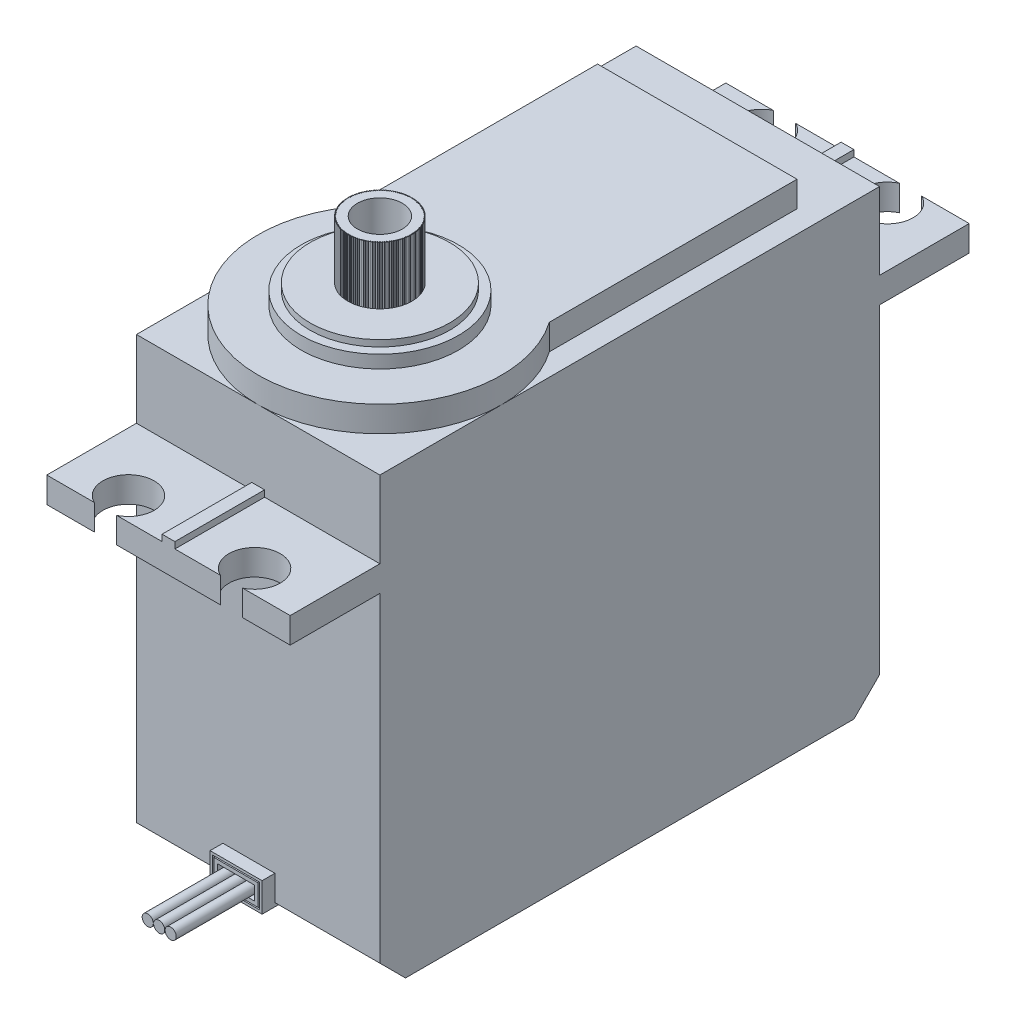
from build123d import *

# Parameters (mm, degrees)
SKETCH1_W            = 19
SKETCH1_H            = 39
BOSS_EXTRUDE1_DEPTH  = 35
SKETCH2_R            = 9.5
SKETCH2_R_2          = 6.134047939
BOSS_EXTRUDE2_DEPTH  = 2
SKETCH2_4_R          = 6.134047939
SKETCH2_4_R_2        = 5.444706805
BOSS_EXTRUDE3_DEPTH  = 3
SKETCH2_5_R          = 5.444706805
SKETCH2_5_R_2        = 2.5
BOSS_EXTRUDE4_DEPTH  = 3.5
SKETCH2_6_R          = 2.5
SKETCH2_6_R_2        = 1.75
BOSS_EXTRUDE5_DEPTH  = 8
BOSS_EXTRUDE6_DEPTH  = 2
SKETCH3_3_W          = 1
SKETCH3_3_H          = 7
BOSS_EXTRUDE7_DEPTH  = 2.5
CUT_EXTRUDE1_DEPTH   = 5
BOSS_EXTRUDE8_DEPTH  = 1
BOSS_EXTRUDE9_DEPTH  = 1
BOSS_EXTRUDE9_DRAFT  = 6
SKETCH6_4_R          = 0.434631118
BOSS_EXTRUDE10_DEPTH = 7
CHAMFER1_SIZE        = 2


with BuildPart() as part:
    # Sketch1 → Boss-Extrude1 (new body)
    with BuildSketch(Plane(origin=(0, 0, 0), x_dir=(1, 0, 0), z_dir=(0, 1, 0))):
        with Locations((9.5, 19.5)):
            Rectangle(SKETCH1_W, SKETCH1_H)
    extrude(amount=BOSS_EXTRUDE1_DEPTH)

    # Sketch2 → Boss-Extrude2 (add)
    # profile 1 of 2: a face of its own
    with BuildSketch(Plane(origin=(0, 35, 0), x_dir=(1, 0, 0), z_dir=(0, 1, 0))):
        with BuildLine():
            ThreePointArc((1.715067899, 14.944706805), (9.5, 19), (17.284932101, 14.944706805))
            Line((17.284932101, 14.944706805), (17.284932101, 34.275553608))
            Line((17.284932101, 34.275553608), (1.715067899, 34.275553608))
            Line((1.715067899, 34.275553608), (1.715067899, 14.944706805))
        make_face()
    # profile 2 of 2: a face of its own
    with BuildSketch(Plane(origin=(0, 35, 0), x_dir=(1, 0, 0), z_dir=(0, 1, 0))):
        with Locations((9.5, 9.5)):
            Circle(SKETCH2_R)
        with Locations(Location((9.5, 9.5, 0), (0, 0, 270))):
            Circle(SKETCH2_R_2, mode=Mode.SUBTRACT)
    extrude(amount=BOSS_EXTRUDE2_DEPTH)

    # Sketch2<4> → Boss-Extrude3 (add)
    with BuildSketch(Plane(origin=(0, 35, 0), x_dir=(1, 0, 0), z_dir=(0, 1, 0))):
        with Locations(Location((9.5, 9.5, 0), (0, 0, 270))):
            Circle(SKETCH2_4_R)
        with Locations(Location((9.5, 9.5, 0), (0, 0, 270))):
            Circle(SKETCH2_4_R_2, mode=Mode.SUBTRACT)
    extrude(amount=BOSS_EXTRUDE3_DEPTH)

    # Sketch2<5> → Boss-Extrude4 (add)
    with BuildSketch(Plane(origin=(0, 35, 0), x_dir=(1, 0, 0), z_dir=(0, 1, 0))):
        with Locations(Location((9.5, 9.5, 0), (0, 0, 270))):
            Circle(SKETCH2_5_R)
        with Locations(Location((9.5, 9.5, 0), (0, 0, 270))):
            Circle(SKETCH2_5_R_2, mode=Mode.SUBTRACT)
    extrude(amount=BOSS_EXTRUDE4_DEPTH)

    # Sketch2<6> → Boss-Extrude5 (add)
    with BuildSketch(Plane(origin=(0, 35, 0), x_dir=(1, 0, 0), z_dir=(0, 1, 0))):
        with Locations(Location((9.5, 9.5, 0), (0, 0, 270))):
            Circle(SKETCH2_6_R)
        with Locations(Location((9.5, 9.5, 0), (0, 0, 270))):
            Circle(SKETCH2_6_R_2, mode=Mode.SUBTRACT)
    extrude(amount=BOSS_EXTRUDE5_DEPTH)

    # Sketch3 → Boss-Extrude6 (add)
    with BuildSketch(Plane(origin=(0, 27, 0), x_dir=(1, 0, 0), z_dir=(0, 1, 0))):
        with BuildLine():
            Line((9, 0), (0, 0))
            Line((0, 0), (0, -7))
            Line((0, -7), (3.705809907, -7))
            ThreePointArc((3.705809907, -7), (4.579641768, -3.200995309), (5.453473629, -7))
            Line((5.453473629, -7), (9, -7))
            Line((9, -7), (9, 0))
        make_face()
        with BuildLine():
            Line((19, 0), (10, 0))
            Line((10, 0), (10, -7))
            Line((10, -7), (13.546526371, -7))
            ThreePointArc((13.546526371, -7), (14.420358232, -3.200995309), (15.294190093, -7))
            Line((15.294190093, -7), (19, -7))
            Line((19, -7), (19, 0))
        make_face()
        with BuildLine():
            Line((10, 46), (10, 39))
            Line((10, 39), (19, 39))
            Line((19, 39), (19, 46))
            Line((19, 46), (15.294190093, 46))
            ThreePointArc((15.294190093, 46), (14.420358232, 42.200995309), (13.546526371, 46))
            Line((13.546526371, 46), (10, 46))
        make_face()
        with BuildLine():
            Line((0, 46), (0, 39))
            Line((0, 39), (9, 39))
            Line((9, 39), (9, 46))
            Line((9, 46), (5.453473629, 46))
            ThreePointArc((5.453473629, 46), (4.579641768, 42.200995309), (3.705809907, 46))
            Line((3.705809907, 46), (0, 46))
        make_face()
    extrude(amount=BOSS_EXTRUDE6_DEPTH)

    # Sketch3<3> → Boss-Extrude7 (add)
    with BuildSketch(Plane(origin=(0, 27, 0), x_dir=(1, 0, 0), z_dir=(0, 1, 0))):
        Polygon((9, 46), (9, 39), (10, 39), (10, 46), (9.5, 46), align=None)
        with Locations((9.5, -3.5)):
            Rectangle(SKETCH3_3_W, SKETCH3_3_H)
    extrude(amount=BOSS_EXTRUDE7_DEPTH)

    # Sketch5 → Cut-Extrude1 (cut)
    with BuildSketch(Plane(origin=(0, 43, 0), x_dir=(1, 0, 0), z_dir=(0, 1, 0))):
        with BuildLine():
            Line((9.501733369, 7.074774865), (9.446313194, 7.007687285))
            ThreePointArc((9.446313194, 7.007687285), (9.502827188, 6.999662997), (9.559341183, 7.007687285))
            Line((9.559341183, 7.007687285), (9.501733369, 7.074774865))
        make_face()
        with BuildLine():
            Line((9.374804517, 7.078007835), (9.428822288, 7.007997235))
            ThreePointArc((9.428822288, 7.007997235), (9.371965786, 7.002941659), (9.3159492, 7.013912663))
            Line((9.3159492, 7.013912663), (9.374804517, 7.078007835))
        make_face()
        with BuildLine():
            Line((9.248218817, 7.087879316), (9.298498487, 7.015137592))
            ThreePointArc((9.298498487, 7.015137592), (9.241455316, 7.013064583), (9.186089677, 7.026952234))
            Line((9.186089677, 7.026952234), (9.248218817, 7.087879316))
        make_face()
        with BuildLine():
            Line((9.122323232, 7.104362253), (9.168726988, 7.029088784))
            ThreePointArc((9.168726988, 7.029088784), (9.111653499, 7.030004025), (9.057090561, 7.046770257))
            Line((9.057090561, 7.046770257), (9.122323232, 7.104362253))
        make_face()
        with BuildLine():
            Line((8.997462832, 7.127411466), (9.039863485, 7.049812572))
            ThreePointArc((9.039863485, 7.049812572), (8.982916113, 7.053713554), (8.929305429, 7.073312412))
            Line((8.929305429, 7.073312412), (8.997462832, 7.127411466))
        make_face()
        with BuildLine():
            Line((8.873979852, 7.156963779), (8.912261184, 7.077252153))
            ThreePointArc((8.912261184, 7.077252153), (8.855596018, 7.084128184), (8.80308453, 7.106505949))
            Line((8.80308453, 7.106505949), (8.873979852, 7.156963779))
        make_face()
        with BuildLine():
            Line((8.75221275, 7.192938192), (8.786269834, 7.111332318))
            ThreePointArc((8.786269834, 7.111332318), (8.73004219, 7.121164551), (8.678773829, 7.146259887))
            Line((8.678773829, 7.146259887), (8.75221275, 7.192938192))
        make_face()
        with BuildLine():
            Line((8.632495281, 7.235236101), (8.662234769, 7.151959655))
            ThreePointArc((8.662234769, 7.151959655), (8.606598763, 7.164721141), (8.556714051, 7.192465263))
            Line((8.556714051, 7.192465263), (8.632495281, 7.235236101))
        make_face()
        with BuildLine():
            Line((8.515155581, 7.28374157), (8.540495961, 7.199022807))
            ThreePointArc((8.540495961, 7.199022807), (8.485604086, 7.214678567), (8.437239755, 7.244995432))
            Line((8.437239755, 7.244995432), (8.515155581, 7.28374157))
        make_face()
        with BuildLine():
            Line((8.400515272, 7.338321649), (8.421387086, 7.252392777))
            ThreePointArc((8.421387086, 7.252392777), (8.367389798, 7.270899901), (8.32067841, 7.303706411))
            Line((8.32067841, 7.303706411), (8.400515272, 7.338321649))
        make_face()
        with BuildLine():
            Line((8.288888574, 7.398826739), (8.305234614, 7.311923283))
            ThreePointArc((8.305234614, 7.311923283), (8.252279915, 7.333231043), (8.207349504, 7.368437278))
            Line((8.207349504, 7.368437278), (8.288888574, 7.398826739))
        make_face()
        with BuildLine():
            Line((8.180581448, 7.465090999), (8.192356911, 7.377451155))
            ThreePointArc((8.192356911, 7.377451155), (8.140589947, 7.401501149), (8.097563664, 7.43901061))
            Line((8.097563664, 7.43901061), (8.180581448, 7.465090999))
        make_face()
        with BuildLine():
            Line((8.075890757, 7.536932802), (8.083063367, 7.448796786))
            ThreePointArc((8.083063367, 7.448796786), (8.032626027, 7.475523094), (7.991621803, 7.515232971))
            Line((7.991621803, 7.515232971), (8.075890757, 7.536932802))
        make_face()
        with BuildLine():
            Line((7.975103451, 7.614155237), (7.977653548, 7.525764623))
            ThreePointArc((7.977653548, 7.525764623), (7.928684077, 7.555093989), (7.889814303, 7.596895441))
            Line((7.889814303, 7.596895441), (7.975103451, 7.614155237))
        make_face()
        with BuildLine():
            Line((7.878495779, 7.69654664), (7.876416374, 7.608143701))
            ThreePointArc((7.876416374, 7.608143701), (7.829048995, 7.639995736), (7.792420209, 7.683774188))
            Line((7.792420209, 7.683774188), (7.878495779, 7.69654664))
        make_face()
        with BuildLine():
            Line((7.786332538, 7.783881185), (7.779629331, 7.695708226))
            ThreePointArc((7.779629331, 7.695708226), (7.733993874, 7.729995626), (7.699706473, 7.775631083))
            Line((7.699706473, 7.775631083), (7.786332538, 7.783881185))
        make_face()
        with BuildLine():
            Line((7.698866341, 7.875919491), (7.687557704, 7.788218189))
            ThreePointArc((7.687557704, 7.788218189), (7.643779252, 7.824846975), (7.611927217, 7.872214354))
            Line((7.611927217, 7.872214354), (7.698866341, 7.875919491))
        make_face()
        with BuildLine():
            Line((7.616336925, 7.972409289), (7.600453855, 7.885420027))
            ThreePointArc((7.600453855, 7.885420027), (7.558652403, 7.924289802), (7.529323037, 7.973259272))
            Line((7.529323037, 7.973259272), (7.616336925, 7.972409289))
        make_face()
        with BuildLine():
            Line((7.5389705, 8.073086108), (7.51855653, 7.987047317))
            ThreePointArc((7.51855653, 7.987047317), (7.478846653, 8.028051541), (7.452120345, 8.078488881))
            Line((7.452120345, 8.078488881), (7.5389705, 8.073086108))
        make_face()
        with BuildLine():
            Line((7.466979119, 8.177673998), (7.442090204, 8.092821505))
            ThreePointArc((7.442090204, 8.092821505), (7.404580743, 8.135847788), (7.380530749, 8.187614752))
            Line((7.380530749, 8.187614752), (7.466979119, 8.177673998))
        make_face()
        with BuildLine():
            Line((7.400560108, 8.285886291), (7.371264466, 8.202452671))
            ThreePointArc((7.371264466, 8.202452671), (7.336058232, 8.247383082), (7.314750471, 8.300337781))
            Line((7.314750471, 8.300337781), (7.400560108, 8.285886291))
        make_face()
        with BuildLine():
            Line((7.339895515, 8.397426386), (7.306273444, 8.315640324))
            ThreePointArc((7.306273444, 8.315640324), (7.273466934, 8.362351712), (7.25495981, 8.416349))
            Line((7.25495981, 8.416349), (7.339895515, 8.397426386))
        make_face()
        with BuildLine():
            Line((7.285151619, 8.511988559), (7.247295273, 8.432074225))
            ThreePointArc((7.247295273, 8.432074225), (7.216978409, 8.480438556), (7.201322649, 8.535330431))
            Line((7.201322649, 8.535330431), (7.285151619, 8.511988559))
        make_face()
        with BuildLine():
            Line((7.236478468, 8.629258802), (7.19449161, 8.551435236))
            ThreePointArc((7.19449161, 8.551435236), (7.166747488, 8.601319948), (7.153986002, 8.656955954))
            Line((7.153986002, 8.656955954), (7.236478468, 8.629258802))
        make_face()
        with BuildLine():
            Line((7.194009473, 8.748915687), (7.148007186, 8.673396197))
            ThreePointArc((7.148007186, 8.673396197), (7.12291185, 8.724664559), (7.113079616, 8.780892203))
            Line((7.113079616, 8.780892203), (7.194009473, 8.748915687))
        make_face()
        with BuildLine():
            Line((7.157861037, 8.870631241), (7.10796941, 8.797622822))
            ThreePointArc((7.10796941, 8.797622822), (7.085591645, 8.850134311), (7.078715613, 8.906799476))
            Line((7.078715613, 8.906799476), (7.157861037, 8.870631241))
        make_face()
        with BuildLine():
            Line((7.128132241, 8.994071851), (7.074488023, 8.923774614))
            ThreePointArc((7.074488023, 8.923774614), (7.054889165, 8.977385299), (7.050988183, 9.03433267))
            Line((7.050988183, 9.03433267), (7.128132241, 8.994071851))
        make_face()
        with BuildLine():
            Line((7.10490457, 9.118899175), (7.047654796, 9.0515058))
            ThreePointArc((7.047654796, 9.0515058), (7.030888564, 9.106068738), (7.029973323, 9.163142226))
            Line((7.029973323, 9.163142226), (7.10490457, 9.118899175))
        make_face()
        with BuildLine():
            Line((7.088241689, 9.24477107), (7.027543277, 9.180466277))
            ThreePointArc((7.027543277, 9.180466277), (7.013655627, 9.235831915), (7.015728635, 9.292875086))
            Line((7.015728635, 9.292875086), (7.088241689, 9.24477107))
        make_face()
        with BuildLine():
            Line((7.07818927, 9.37134253), (7.01420859, 9.310302573))
            ThreePointArc((7.01420859, 9.310302573), (7.003237586, 9.366319159), (7.008293163, 9.423175661))
            Line((7.008293163, 9.423175661), (7.07818927, 9.37134253))
        make_face()
        with BuildLine():
            Line((7.074774865, 9.498266631), (7.007687285, 9.440658817))
            ThreePointArc((7.007687285, 9.440658817), (6.999662997, 9.497172812), (7.007687285, 9.553686806))
            Line((7.007687285, 9.553686806), (7.074774865, 9.498266631))
        make_face()
        with BuildLine():
            Line((7.078007835, 9.625195483), (7.007997235, 9.571177712))
            ThreePointArc((7.007997235, 9.571177712), (7.002941659, 9.628034214), (7.013912663, 9.6840508))
            Line((7.013912663, 9.6840508), (7.078007835, 9.625195483))
        make_face()
        with BuildLine():
            Line((7.087879316, 9.751781183), (7.015137592, 9.701501513))
            ThreePointArc((7.015137592, 9.701501513), (7.013064583, 9.758544684), (7.026952234, 9.813910323))
            Line((7.026952234, 9.813910323), (7.087879316, 9.751781183))
        make_face()
        with BuildLine():
            Line((7.104362253, 9.877676768), (7.029088784, 9.831273012))
            ThreePointArc((7.029088784, 9.831273012), (7.030004025, 9.888346501), (7.046770257, 9.942909439))
            Line((7.046770257, 9.942909439), (7.104362253, 9.877676768))
        make_face()
        with BuildLine():
            Line((7.127411466, 10.002537168), (7.049812572, 9.960136515))
            ThreePointArc((7.049812572, 9.960136515), (7.053713554, 10.017083887), (7.073312412, 10.070694571))
            Line((7.073312412, 10.070694571), (7.127411466, 10.002537168))
        make_face()
        with BuildLine():
            Line((7.156963779, 10.126020148), (7.077252153, 10.087738816))
            ThreePointArc((7.077252153, 10.087738816), (7.084128184, 10.144403982), (7.106505949, 10.19691547))
            Line((7.106505949, 10.19691547), (7.156963779, 10.126020148))
        make_face()
        with BuildLine():
            Line((7.192938192, 10.24778725), (7.111332318, 10.213730166))
            ThreePointArc((7.111332318, 10.213730166), (7.121164551, 10.26995781), (7.146259887, 10.321226171))
            Line((7.146259887, 10.321226171), (7.192938192, 10.24778725))
        make_face()
        with BuildLine():
            Line((7.235236101, 10.367504719), (7.151959655, 10.337765231))
            ThreePointArc((7.151959655, 10.337765231), (7.164721141, 10.393401237), (7.192465263, 10.443285949))
            Line((7.192465263, 10.443285949), (7.235236101, 10.367504719))
        make_face()
        with BuildLine():
            Line((7.28374157, 10.484844419), (7.199022807, 10.459504039))
            ThreePointArc((7.199022807, 10.459504039), (7.214678567, 10.514395914), (7.244995432, 10.562760245))
            Line((7.244995432, 10.562760245), (7.28374157, 10.484844419))
        make_face()
        with BuildLine():
            Line((7.338321649, 10.599484728), (7.252392777, 10.578612914))
            ThreePointArc((7.252392777, 10.578612914), (7.270899901, 10.632610202), (7.303706411, 10.67932159))
            Line((7.303706411, 10.67932159), (7.338321649, 10.599484728))
        make_face()
        with BuildLine():
            Line((7.398826739, 10.711111426), (7.311923283, 10.694765386))
            ThreePointArc((7.311923283, 10.694765386), (7.333231043, 10.747720085), (7.368437278, 10.792650496))
            Line((7.368437278, 10.792650496), (7.398826739, 10.711111426))
        make_face()
        with BuildLine():
            Line((7.465090999, 10.819418552), (7.377451155, 10.807643089))
            ThreePointArc((7.377451155, 10.807643089), (7.401501149, 10.859410053), (7.43901061, 10.902436336))
            Line((7.43901061, 10.902436336), (7.465090999, 10.819418552))
        make_face()
        with BuildLine():
            Line((7.536932802, 10.924109243), (7.448796786, 10.916936633))
            ThreePointArc((7.448796786, 10.916936633), (7.475523094, 10.967373973), (7.515232971, 11.008378197))
            Line((7.515232971, 11.008378197), (7.536932802, 10.924109243))
        make_face()
        with BuildLine():
            Line((7.614155237, 11.024896549), (7.525764623, 11.022346452))
            ThreePointArc((7.525764623, 11.022346452), (7.555093989, 11.071315923), (7.596895441, 11.110185697))
            Line((7.596895441, 11.110185697), (7.614155237, 11.024896549))
        make_face()
        with BuildLine():
            Line((7.69654664, 11.121504221), (7.608143701, 11.123583626))
            ThreePointArc((7.608143701, 11.123583626), (7.639995736, 11.170951005), (7.683774188, 11.207579791))
            Line((7.683774188, 11.207579791), (7.69654664, 11.121504221))
        make_face()
        with BuildLine():
            Line((7.783881185, 11.213667462), (7.695708226, 11.220370669))
            ThreePointArc((7.695708226, 11.220370669), (7.729995626, 11.266006126), (7.775631083, 11.300293527))
            Line((7.775631083, 11.300293527), (7.783881185, 11.213667462))
        make_face()
        with BuildLine():
            Line((7.875919491, 11.301133659), (7.788218189, 11.312442296))
            ThreePointArc((7.788218189, 11.312442296), (7.824846975, 11.356220748), (7.872214354, 11.388072783))
            Line((7.872214354, 11.388072783), (7.875919491, 11.301133659))
        make_face()
        with BuildLine():
            Line((7.972409289, 11.383663075), (7.885420027, 11.399546145))
            ThreePointArc((7.885420027, 11.399546145), (7.924289802, 11.441347597), (7.973259272, 11.470676963))
            Line((7.973259272, 11.470676963), (7.972409289, 11.383663075))
        make_face()
        with BuildLine():
            Line((8.073086108, 11.4610295), (7.987047317, 11.48144347))
            ThreePointArc((7.987047317, 11.48144347), (8.028051541, 11.521153347), (8.078488881, 11.547879655))
            Line((8.078488881, 11.547879655), (8.073086108, 11.4610295))
        make_face()
        with BuildLine():
            Line((8.177673998, 11.533020881), (8.092821505, 11.557909796))
            ThreePointArc((8.092821505, 11.557909796), (8.135847788, 11.595419257), (8.187614752, 11.619469251))
            Line((8.187614752, 11.619469251), (8.177673998, 11.533020881))
        make_face()
        with BuildLine():
            Line((8.285886291, 11.599439892), (8.202452671, 11.628735534))
            ThreePointArc((8.202452671, 11.628735534), (8.247383082, 11.663941768), (8.300337781, 11.685249529))
            Line((8.300337781, 11.685249529), (8.285886291, 11.599439892))
        make_face()
        with BuildLine():
            Line((8.397426386, 11.660104485), (8.315640324, 11.693726556))
            ThreePointArc((8.315640324, 11.693726556), (8.362351712, 11.726533066), (8.416349, 11.74504019))
            Line((8.416349, 11.74504019), (8.397426386, 11.660104485))
        make_face()
        with BuildLine():
            Line((8.511988559, 11.714848381), (8.432074225, 11.752704727))
            ThreePointArc((8.432074225, 11.752704727), (8.480438556, 11.783021591), (8.535330431, 11.798677351))
            Line((8.535330431, 11.798677351), (8.511988559, 11.714848381))
        make_face()
        with BuildLine():
            Line((8.629258802, 11.763521532), (8.551435236, 11.80550839))
            ThreePointArc((8.551435236, 11.80550839), (8.601319948, 11.833252512), (8.656955954, 11.846013998))
            Line((8.656955954, 11.846013998), (8.629258802, 11.763521532))
        make_face()
        with BuildLine():
            Line((8.748915687, 11.805990527), (8.673396197, 11.851992814))
            ThreePointArc((8.673396197, 11.851992814), (8.724664559, 11.87708815), (8.780892203, 11.886920384))
            Line((8.780892203, 11.886920384), (8.748915687, 11.805990527))
        make_face()
        with BuildLine():
            Line((8.870631241, 11.842138963), (8.797622822, 11.89203059))
            ThreePointArc((8.797622822, 11.89203059), (8.850134311, 11.914408355), (8.906799476, 11.921284387))
            Line((8.906799476, 11.921284387), (8.870631241, 11.842138963))
        make_face()
        with BuildLine():
            Line((8.994071851, 11.871867759), (8.923774614, 11.925511977))
            ThreePointArc((8.923774614, 11.925511977), (8.977385299, 11.945110835), (9.03433267, 11.949011817))
            Line((9.03433267, 11.949011817), (8.994071851, 11.871867759))
        make_face()
        with BuildLine():
            Line((9.118899175, 11.89509543), (9.0515058, 11.952345204))
            ThreePointArc((9.0515058, 11.952345204), (9.106068738, 11.969111436), (9.163142226, 11.970026677))
            Line((9.163142226, 11.970026677), (9.118899175, 11.89509543))
        make_face()
        with BuildLine():
            Line((9.24477107, 11.911758311), (9.180466277, 11.972456723))
            ThreePointArc((9.180466277, 11.972456723), (9.235831915, 11.986344373), (9.292875086, 11.984271365))
            Line((9.292875086, 11.984271365), (9.24477107, 11.911758311))
        make_face()
        with BuildLine():
            Line((9.37134253, 11.92181073), (9.310302573, 11.98579141))
            ThreePointArc((9.310302573, 11.98579141), (9.366319159, 11.996762414), (9.423175661, 11.991706837))
            Line((9.423175661, 11.991706837), (9.37134253, 11.92181073))
        make_face()
        with BuildLine():
            Line((9.498266631, 11.925225135), (9.440658817, 11.992312715))
            ThreePointArc((9.440658817, 11.992312715), (9.497172812, 12.000337003), (9.553686806, 11.992312715))
            Line((9.553686806, 11.992312715), (9.498266631, 11.925225135))
        make_face()
        with BuildLine():
            Line((9.625195483, 11.921992165), (9.571177712, 11.992002765))
            ThreePointArc((9.571177712, 11.992002765), (9.628034214, 11.997058341), (9.6840508, 11.986087337))
            Line((9.6840508, 11.986087337), (9.625195483, 11.921992165))
        make_face()
        with BuildLine():
            Line((9.751781183, 11.912120684), (9.701501513, 11.984862408))
            ThreePointArc((9.701501513, 11.984862408), (9.758544684, 11.986935417), (9.813910323, 11.973047766))
            Line((9.813910323, 11.973047766), (9.751781183, 11.912120684))
        make_face()
        with BuildLine():
            Line((9.877676768, 11.895637747), (9.831273012, 11.970911216))
            ThreePointArc((9.831273012, 11.970911216), (9.888346501, 11.969995975), (9.942909439, 11.953229743))
            Line((9.942909439, 11.953229743), (9.877676768, 11.895637747))
        make_face()
        with BuildLine():
            Line((10.002537168, 11.872588534), (9.960136515, 11.950187428))
            ThreePointArc((9.960136515, 11.950187428), (10.017083887, 11.946286446), (10.070694571, 11.926687588))
            Line((10.070694571, 11.926687588), (10.002537168, 11.872588534))
        make_face()
        with BuildLine():
            Line((10.126020148, 11.843036221), (10.087738816, 11.922747847))
            ThreePointArc((10.087738816, 11.922747847), (10.144403982, 11.915871816), (10.19691547, 11.893494051))
            Line((10.19691547, 11.893494051), (10.126020148, 11.843036221))
        make_face()
        with BuildLine():
            Line((10.24778725, 11.807061808), (10.213730166, 11.888667682))
            ThreePointArc((10.213730166, 11.888667682), (10.26995781, 11.878835449), (10.321226171, 11.853740113))
            Line((10.321226171, 11.853740113), (10.24778725, 11.807061808))
        make_face()
        with BuildLine():
            Line((10.367504719, 11.764763899), (10.337765231, 11.848040345))
            ThreePointArc((10.337765231, 11.848040345), (10.393401237, 11.835278859), (10.443285949, 11.807534737))
            Line((10.443285949, 11.807534737), (10.367504719, 11.764763899))
        make_face()
        with BuildLine():
            Line((10.484844419, 11.71625843), (10.459504039, 11.800977193))
            ThreePointArc((10.459504039, 11.800977193), (10.514395914, 11.785321433), (10.562760245, 11.755004568))
            Line((10.562760245, 11.755004568), (10.484844419, 11.71625843))
        make_face()
        with BuildLine():
            Line((10.599484728, 11.661678351), (10.578612914, 11.747607223))
            ThreePointArc((10.578612914, 11.747607223), (10.632610202, 11.729100099), (10.67932159, 11.696293589))
            Line((10.67932159, 11.696293589), (10.599484728, 11.661678351))
        make_face()
        with BuildLine():
            Line((10.711111426, 11.601173261), (10.694765386, 11.688076717))
            ThreePointArc((10.694765386, 11.688076717), (10.747720085, 11.666768957), (10.792650496, 11.631562722))
            Line((10.792650496, 11.631562722), (10.711111426, 11.601173261))
        make_face()
        with BuildLine():
            Line((10.819418552, 11.534909001), (10.807643089, 11.622548845))
            ThreePointArc((10.807643089, 11.622548845), (10.859410053, 11.598498851), (10.902436336, 11.56098939))
            Line((10.902436336, 11.56098939), (10.819418552, 11.534909001))
        make_face()
        with BuildLine():
            Line((10.924109243, 11.463067198), (10.916936633, 11.551203214))
            ThreePointArc((10.916936633, 11.551203214), (10.967373973, 11.524476906), (11.008378197, 11.484767029))
            Line((11.008378197, 11.484767029), (10.924109243, 11.463067198))
        make_face()
        with BuildLine():
            Line((11.024896549, 11.385844763), (11.022346452, 11.474235377))
            ThreePointArc((11.022346452, 11.474235377), (11.071315923, 11.444906011), (11.110185697, 11.403104559))
            Line((11.110185697, 11.403104559), (11.024896549, 11.385844763))
        make_face()
        with BuildLine():
            Line((11.121504221, 11.30345336), (11.123583626, 11.391856299))
            ThreePointArc((11.123583626, 11.391856299), (11.170951005, 11.360004264), (11.207579791, 11.316225812))
            Line((11.207579791, 11.316225812), (11.121504221, 11.30345336))
        make_face()
        with BuildLine():
            Line((11.213667462, 11.216118815), (11.220370669, 11.304291774))
            ThreePointArc((11.220370669, 11.304291774), (11.266006126, 11.270004374), (11.300293527, 11.224368917))
            Line((11.300293527, 11.224368917), (11.213667462, 11.216118815))
        make_face()
        with BuildLine():
            Line((11.301133659, 11.124080509), (11.312442296, 11.211781811))
            ThreePointArc((11.312442296, 11.211781811), (11.356220748, 11.175153025), (11.388072783, 11.127785646))
            Line((11.388072783, 11.127785646), (11.301133659, 11.124080509))
        make_face()
        with BuildLine():
            Line((11.383663075, 11.027590711), (11.399546145, 11.114579973))
            ThreePointArc((11.399546145, 11.114579973), (11.441347597, 11.075710198), (11.470676963, 11.026740728))
            Line((11.470676963, 11.026740728), (11.383663075, 11.027590711))
        make_face()
        with BuildLine():
            Line((11.4610295, 10.926913892), (11.48144347, 11.012952683))
            ThreePointArc((11.48144347, 11.012952683), (11.521153347, 10.971948459), (11.547879655, 10.921511119))
            Line((11.547879655, 10.921511119), (11.4610295, 10.926913892))
        make_face()
        with BuildLine():
            Line((11.533020881, 10.822326002), (11.557909796, 10.907178495))
            ThreePointArc((11.557909796, 10.907178495), (11.595419257, 10.864152212), (11.619469251, 10.812385248))
            Line((11.619469251, 10.812385248), (11.533020881, 10.822326002))
        make_face()
        with BuildLine():
            Line((11.599439892, 10.714113709), (11.628735534, 10.797547329))
            ThreePointArc((11.628735534, 10.797547329), (11.663941768, 10.752616918), (11.685249529, 10.699662219))
            Line((11.685249529, 10.699662219), (11.599439892, 10.714113709))
        make_face()
        with BuildLine():
            Line((11.660104485, 10.602573614), (11.693726556, 10.684359676))
            ThreePointArc((11.693726556, 10.684359676), (11.726533066, 10.637648288), (11.74504019, 10.583651))
            Line((11.74504019, 10.583651), (11.660104485, 10.602573614))
        make_face()
        with BuildLine():
            Line((11.714848381, 10.488011441), (11.752704727, 10.567925775))
            ThreePointArc((11.752704727, 10.567925775), (11.783021591, 10.519561444), (11.798677351, 10.464669569))
            Line((11.798677351, 10.464669569), (11.714848381, 10.488011441))
        make_face()
        with BuildLine():
            Line((11.763521532, 10.370741198), (11.80550839, 10.448564764))
            ThreePointArc((11.80550839, 10.448564764), (11.833252512, 10.398680052), (11.846013998, 10.343044046))
            Line((11.846013998, 10.343044046), (11.763521532, 10.370741198))
        make_face()
        with BuildLine():
            Line((11.805990527, 10.251084313), (11.851992814, 10.326603803))
            ThreePointArc((11.851992814, 10.326603803), (11.87708815, 10.275335441), (11.886920384, 10.219107797))
            Line((11.886920384, 10.219107797), (11.805990527, 10.251084313))
        make_face()
        with BuildLine():
            Line((11.842138963, 10.129368759), (11.89203059, 10.202377178))
            ThreePointArc((11.89203059, 10.202377178), (11.914408355, 10.149865689), (11.921284387, 10.093200524))
            Line((11.921284387, 10.093200524), (11.842138963, 10.129368759))
        make_face()
        with BuildLine():
            Line((11.871867759, 10.005928149), (11.925511977, 10.076225386))
            ThreePointArc((11.925511977, 10.076225386), (11.945110835, 10.022614701), (11.949011817, 9.96566733))
            Line((11.949011817, 9.96566733), (11.871867759, 10.005928149))
        make_face()
        with BuildLine():
            Line((11.89509543, 9.881100825), (11.952345204, 9.9484942))
            ThreePointArc((11.952345204, 9.9484942), (11.969111436, 9.893931262), (11.970026677, 9.836857774))
            Line((11.970026677, 9.836857774), (11.89509543, 9.881100825))
        make_face()
        with BuildLine():
            Line((11.911758311, 9.75522893), (11.972456723, 9.819533723))
            ThreePointArc((11.972456723, 9.819533723), (11.986344373, 9.764168085), (11.984271365, 9.707124914))
            Line((11.984271365, 9.707124914), (11.911758311, 9.75522893))
        make_face()
        with BuildLine():
            Line((11.92181073, 9.62865747), (11.98579141, 9.689697427))
            ThreePointArc((11.98579141, 9.689697427), (11.996762414, 9.633680841), (11.991706837, 9.576824339))
            Line((11.991706837, 9.576824339), (11.92181073, 9.62865747))
        make_face()
        with BuildLine():
            Line((11.925225135, 9.501733369), (11.992312715, 9.559341183))
            ThreePointArc((11.992312715, 9.559341183), (12.000337003, 9.502827188), (11.992312715, 9.446313194))
            Line((11.992312715, 9.446313194), (11.925225135, 9.501733369))
        make_face()
        with BuildLine():
            Line((11.921992165, 9.374804517), (11.992002765, 9.428822288))
            ThreePointArc((11.992002765, 9.428822288), (11.997058341, 9.371965786), (11.986087337, 9.3159492))
            Line((11.986087337, 9.3159492), (11.921992165, 9.374804517))
        make_face()
        with BuildLine():
            Line((11.912120684, 9.248218817), (11.984862408, 9.298498487))
            ThreePointArc((11.984862408, 9.298498487), (11.986935417, 9.241455316), (11.973047766, 9.186089677))
            Line((11.973047766, 9.186089677), (11.912120684, 9.248218817))
        make_face()
        with BuildLine():
            Line((11.895637747, 9.122323232), (11.970911216, 9.168726988))
            ThreePointArc((11.970911216, 9.168726988), (11.969995975, 9.111653499), (11.953229743, 9.057090561))
            Line((11.953229743, 9.057090561), (11.895637747, 9.122323232))
        make_face()
        with BuildLine():
            Line((11.872588534, 8.997462832), (11.950187428, 9.039863485))
            ThreePointArc((11.950187428, 9.039863485), (11.946286446, 8.982916113), (11.926687588, 8.929305429))
            Line((11.926687588, 8.929305429), (11.872588534, 8.997462832))
        make_face()
        with BuildLine():
            Line((11.843036221, 8.873979852), (11.922747847, 8.912261184))
            ThreePointArc((11.922747847, 8.912261184), (11.915871816, 8.855596018), (11.893494051, 8.80308453))
            Line((11.893494051, 8.80308453), (11.843036221, 8.873979852))
        make_face()
        with BuildLine():
            Line((11.807061808, 8.75221275), (11.888667682, 8.786269834))
            ThreePointArc((11.888667682, 8.786269834), (11.878835449, 8.73004219), (11.853740113, 8.678773829))
            Line((11.853740113, 8.678773829), (11.807061808, 8.75221275))
        make_face()
        with BuildLine():
            Line((11.764763899, 8.632495281), (11.848040345, 8.662234769))
            ThreePointArc((11.848040345, 8.662234769), (11.835278859, 8.606598763), (11.807534737, 8.556714051))
            Line((11.807534737, 8.556714051), (11.764763899, 8.632495281))
        make_face()
        with BuildLine():
            Line((11.71625843, 8.515155581), (11.800977193, 8.540495961))
            ThreePointArc((11.800977193, 8.540495961), (11.785321433, 8.485604086), (11.755004568, 8.437239755))
            Line((11.755004568, 8.437239755), (11.71625843, 8.515155581))
        make_face()
        with BuildLine():
            Line((11.661678351, 8.400515272), (11.747607223, 8.421387086))
            ThreePointArc((11.747607223, 8.421387086), (11.729100099, 8.367389798), (11.696293589, 8.32067841))
            Line((11.696293589, 8.32067841), (11.661678351, 8.400515272))
        make_face()
        with BuildLine():
            Line((11.601173261, 8.288888574), (11.688076717, 8.305234614))
            ThreePointArc((11.688076717, 8.305234614), (11.666768957, 8.252279915), (11.631562722, 8.207349504))
            Line((11.631562722, 8.207349504), (11.601173261, 8.288888574))
        make_face()
        with BuildLine():
            Line((11.534909001, 8.180581448), (11.622548845, 8.192356911))
            ThreePointArc((11.622548845, 8.192356911), (11.598498851, 8.140589947), (11.56098939, 8.097563664))
            Line((11.56098939, 8.097563664), (11.534909001, 8.180581448))
        make_face()
        with BuildLine():
            Line((11.463067198, 8.075890757), (11.551203214, 8.083063367))
            ThreePointArc((11.551203214, 8.083063367), (11.524476906, 8.032626027), (11.484767029, 7.991621803))
            Line((11.484767029, 7.991621803), (11.463067198, 8.075890757))
        make_face()
        with BuildLine():
            Line((11.385844763, 7.975103451), (11.474235377, 7.977653548))
            ThreePointArc((11.474235377, 7.977653548), (11.444906011, 7.928684077), (11.403104559, 7.889814303))
            Line((11.403104559, 7.889814303), (11.385844763, 7.975103451))
        make_face()
        with BuildLine():
            Line((11.30345336, 7.878495779), (11.391856299, 7.876416374))
            ThreePointArc((11.391856299, 7.876416374), (11.360004264, 7.829048995), (11.316225812, 7.792420209))
            Line((11.316225812, 7.792420209), (11.30345336, 7.878495779))
        make_face()
        with BuildLine():
            Line((11.216118815, 7.786332538), (11.304291774, 7.779629331))
            ThreePointArc((11.304291774, 7.779629331), (11.270004374, 7.733993874), (11.224368917, 7.699706473))
            Line((11.224368917, 7.699706473), (11.216118815, 7.786332538))
        make_face()
        with BuildLine():
            Line((11.124080509, 7.698866341), (11.211781811, 7.687557704))
            ThreePointArc((11.211781811, 7.687557704), (11.175153025, 7.643779252), (11.127785646, 7.611927217))
            Line((11.127785646, 7.611927217), (11.124080509, 7.698866341))
        make_face()
        with BuildLine():
            Line((11.027590711, 7.616336925), (11.114579973, 7.600453855))
            ThreePointArc((11.114579973, 7.600453855), (11.075710198, 7.558652403), (11.026740728, 7.529323037))
            Line((11.026740728, 7.529323037), (11.027590711, 7.616336925))
        make_face()
        with BuildLine():
            Line((10.926913892, 7.5389705), (11.012952683, 7.51855653))
            ThreePointArc((11.012952683, 7.51855653), (10.971948459, 7.478846653), (10.921511119, 7.452120345))
            Line((10.921511119, 7.452120345), (10.926913892, 7.5389705))
        make_face()
        with BuildLine():
            Line((10.822326002, 7.466979119), (10.907178495, 7.442090204))
            ThreePointArc((10.907178495, 7.442090204), (10.864152212, 7.404580743), (10.812385248, 7.380530749))
            Line((10.812385248, 7.380530749), (10.822326002, 7.466979119))
        make_face()
        with BuildLine():
            Line((10.714113709, 7.400560108), (10.797547329, 7.371264466))
            ThreePointArc((10.797547329, 7.371264466), (10.752616918, 7.336058232), (10.699662219, 7.314750471))
            Line((10.699662219, 7.314750471), (10.714113709, 7.400560108))
        make_face()
        with BuildLine():
            Line((10.602573614, 7.339895515), (10.684359676, 7.306273444))
            ThreePointArc((10.684359676, 7.306273444), (10.637648288, 7.273466934), (10.583651, 7.25495981))
            Line((10.583651, 7.25495981), (10.602573614, 7.339895515))
        make_face()
        with BuildLine():
            Line((10.488011441, 7.285151619), (10.567925775, 7.247295273))
            ThreePointArc((10.567925775, 7.247295273), (10.519561444, 7.216978409), (10.464669569, 7.201322649))
            Line((10.464669569, 7.201322649), (10.488011441, 7.285151619))
        make_face()
        with BuildLine():
            Line((10.370741198, 7.236478468), (10.448564764, 7.19449161))
            ThreePointArc((10.448564764, 7.19449161), (10.398680052, 7.166747488), (10.343044046, 7.153986002))
            Line((10.343044046, 7.153986002), (10.370741198, 7.236478468))
        make_face()
        with BuildLine():
            Line((10.251084313, 7.194009473), (10.326603803, 7.148007186))
            ThreePointArc((10.326603803, 7.148007186), (10.275335441, 7.12291185), (10.219107797, 7.113079616))
            Line((10.219107797, 7.113079616), (10.251084313, 7.194009473))
        make_face()
        with BuildLine():
            Line((10.129368759, 7.157861037), (10.202377178, 7.10796941))
            ThreePointArc((10.202377178, 7.10796941), (10.149865689, 7.085591645), (10.093200524, 7.078715613))
            Line((10.093200524, 7.078715613), (10.129368759, 7.157861037))
        make_face()
        with BuildLine():
            Line((10.005928149, 7.128132241), (10.076225386, 7.074488023))
            ThreePointArc((10.076225386, 7.074488023), (10.022614701, 7.054889165), (9.96566733, 7.050988183))
            Line((9.96566733, 7.050988183), (10.005928149, 7.128132241))
        make_face()
        with BuildLine():
            Line((9.881100825, 7.10490457), (9.9484942, 7.047654796))
            ThreePointArc((9.9484942, 7.047654796), (9.893931262, 7.030888564), (9.836857774, 7.029973323))
            Line((9.836857774, 7.029973323), (9.881100825, 7.10490457))
        make_face()
        with BuildLine():
            Line((9.75522893, 7.088241689), (9.819533723, 7.027543277))
            ThreePointArc((9.819533723, 7.027543277), (9.764168085, 7.013655627), (9.707124914, 7.015728635))
            Line((9.707124914, 7.015728635), (9.75522893, 7.088241689))
        make_face()
        with BuildLine():
            Line((9.62865747, 7.07818927), (9.689697427, 7.01420859))
            ThreePointArc((9.689697427, 7.01420859), (9.633680841, 7.003237586), (9.576824339, 7.008293163))
            Line((9.576824339, 7.008293163), (9.62865747, 7.07818927))
        make_face()
    extrude(amount=-CUT_EXTRUDE1_DEPTH, mode=Mode.SUBTRACT)

    # Sketch6 → Boss-Extrude8 (add)
    with BuildSketch(Plane.XY):
        Polygon((6.745252606, 1.712678094), (10.805451026, 1.712678094), (10.805451026, 3.981940331), (6.745252606, 3.981940331), (6.745252606, 2.847309212), align=None)
        Polygon((10.605451026, 1.912678094), (10.605451026, 3.781940331), (6.945252606, 3.781940331), (6.945252606, 2.847309212), (6.945252606, 1.912678094), align=None, mode=Mode.SUBTRACT)
    extrude(amount=BOSS_EXTRUDE8_DEPTH)


with BuildPart() as boss_extrude9_tool:
    # Sketch6<3> → Boss-Extrude9 (with draft: the straight prism first)
    with BuildSketch(Plane.XY):
        Polygon((6.945252606, 1.912678094), (10.605451026, 1.912678094), (10.605451026, 3.781940331), (6.945252606, 3.781940331), (6.945252606, 2.847309212), align=None)
        Polygon((7.445252606, 3.281940331), (7.445252606, 2.847309212), (7.445252606, 2.412678094), (10.105451026, 2.412678094), (10.105451026, 3.281940331), align=None, mode=Mode.SUBTRACT)
    extrude(amount=BOSS_EXTRUDE9_DEPTH)
    # Boss-Extrude9: the draft: its side faces are tilted about the plane it starts from
    boss_extrude9_sides = [boss_extrude9_tool.faces().sort_by_distance(p)[0] for p in [
        (8.775351816, 1.912678094, 0.5),
        (7.445252606, 2.847309212, 0.5),
        (8.775351816, 2.412678094, 0.5),
        (10.105451026, 2.847309212, 0.5),
        (8.775351816, 3.281940331, 0.5),
        (8.775351816, 3.781940331, 0.5),
        (10.605451026, 2.847309212, 0.5),
        (6.945252606, 2.847309212, 0.5),
    ]]
    draft(boss_extrude9_sides, Plane.XY, BOSS_EXTRUDE9_DRAFT)


with BuildPart() as part_1:
    add(part.part)

    # Boss-Extrude9: add boss_extrude9_tool
    add(boss_extrude9_tool.part)

    # Sketch6<4> → Boss-Extrude10 (add)
    with BuildSketch(Plane.XY):
        with Locations(Location((7.879883724, 2.847309212, 0), (0, 0, 180))):
            Circle(SKETCH6_4_R)
        with Locations(Location((8.770780036, 2.847309212, 0), (0, 0, 270))):
            Circle(SKETCH6_4_R)
        with Locations((9.670819907, 2.847309212)):
            Circle(SKETCH6_4_R)
    extrude(amount=BOSS_EXTRUDE10_DEPTH)

    # Chamfer1
    # the kernel refuses this chamfer: 2 mm, written as the material it takes off along each edge
    with BuildSketch(Plane(origin=(24.143365976, 0, -39), x_dir=(0, -0.02749587661058639, 0.9996219169112968), z_dir=(-1, 0, 0))) as chamfer1_piece_1:
        Polygon((CHAMFER1_SIZE * 0.999621916911, CHAMFER1_SIZE * 0.0274958766106), (-CHAMFER1_SIZE * 0.0274958766106, CHAMFER1_SIZE * 0.999621916911), (0, 0), align=None)
    extrude(amount=29.286731952, mode=Mode.SUBTRACT)
    with BuildSketch(Plane(origin=(-5.143365976, 0, 0), x_dir=(0, 0.9996219169112968, 0.027495876610586372), z_dir=(1, 0, 0))) as chamfer1_piece_2_section:
        Polygon((CHAMFER1_SIZE * 0.999621916911, -CHAMFER1_SIZE * 0.0274958766106), (-CHAMFER1_SIZE * 0.0274958766106, -CHAMFER1_SIZE * 0.999621916911), (0, 0), align=None)
    chamfer1_piece_2 = extrude(amount=29.286731952, mode=Mode.PRIVATE)
    chamfer1_piece_2 = split(chamfer1_piece_2, bisect_by=Plane(origin=(6.745252606, 1.838687604, -0.040631215), z_dir=(-1, 0, 0)), keep=Keep.TOP, mode=Mode.PRIVATE)
    chamfer1_piece_2 = split(chamfer1_piece_2, bisect_by=Plane(origin=(0.800943315, 1.712678094, -0.040631215), z_dir=(0, 1, 0)), keep=Keep.TOP, mode=Mode.PRIVATE)
    add(chamfer1_piece_2, mode=Mode.SUBTRACT)
    with BuildSketch(Plane(origin=(-5.143365976, 0, 0), x_dir=(0, 0.9996219169112968, 0.027495876610586372), z_dir=(1, 0, 0))) as chamfer1_piece_3_section:
        Polygon((CHAMFER1_SIZE * 0.999621916911, -CHAMFER1_SIZE * 0.0274958766106), (-CHAMFER1_SIZE * 0.0274958766106, -CHAMFER1_SIZE * 0.999621916911), (0, 0), align=None)
    chamfer1_piece_3 = extrude(amount=29.286731952, mode=Mode.PRIVATE)
    chamfer1_piece_3 = split(chamfer1_piece_3, bisect_by=Plane(origin=(6.745252606, 0.621787742, -0.679429701), z_dir=(-1, 0, 0)), keep=Keep.TOP, mode=Mode.PRIVATE)
    chamfer1_piece_3 = split(chamfer1_piece_3, bisect_by=Plane(origin=(0.800943315, 1.712678094, -0.679429701), z_dir=(0, -1, 0)), keep=Keep.TOP, mode=Mode.PRIVATE)
    add(chamfer1_piece_3, mode=Mode.SUBTRACT)
    with BuildSketch(Plane(origin=(-5.143365976, 0, 0), x_dir=(0, 0.9996219169112968, 0.027495876610586372), z_dir=(1, 0, 0))) as chamfer1_piece_4_section:
        Polygon((CHAMFER1_SIZE * 0.999621916911, -CHAMFER1_SIZE * 0.0274958766106), (-CHAMFER1_SIZE * 0.0274958766106, -CHAMFER1_SIZE * 0.999621916911), (0, 0), align=None)
    chamfer1_piece_4 = extrude(amount=29.286731952, mode=Mode.PRIVATE)
    chamfer1_piece_4 = split(chamfer1_piece_4, bisect_by=Plane(origin=(6.745252606, 0.621787742, -0.679429701), z_dir=(1, 0, 0)), keep=Keep.TOP, mode=Mode.PRIVATE)
    chamfer1_piece_4 = split(chamfer1_piece_4, bisect_by=Plane(origin=(10.805451026, 0.621787742, -0.679429701), z_dir=(-1, 0, 0)), keep=Keep.TOP, mode=Mode.PRIVATE)
    chamfer1_piece_4 = split(chamfer1_piece_4, bisect_by=Plane(origin=(8.775351816, 1.712678094, -0.679429701), z_dir=(0, -1, 0)), keep=Keep.TOP, mode=Mode.PRIVATE)
    add(chamfer1_piece_4, mode=Mode.SUBTRACT)
    with BuildSketch(Plane(origin=(-5.143365976, 0, 0), x_dir=(0, 0.9996219169112968, 0.027495876610586372), z_dir=(1, 0, 0))) as chamfer1_piece_5_section:
        Polygon((CHAMFER1_SIZE * 0.999621916911, -CHAMFER1_SIZE * 0.0274958766106), (-CHAMFER1_SIZE * 0.0274958766106, -CHAMFER1_SIZE * 0.999621916911), (0, 0), align=None)
    chamfer1_piece_5 = extrude(amount=29.286731952, mode=Mode.PRIVATE)
    chamfer1_piece_5 = split(chamfer1_piece_5, bisect_by=Plane(origin=(10.805451026, 1.838687604, -0.040631215), z_dir=(1, 0, 0)), keep=Keep.TOP, mode=Mode.PRIVATE)
    chamfer1_piece_5 = split(chamfer1_piece_5, bisect_by=Plane(origin=(17.474408501, 1.712678094, -0.040631215), z_dir=(0, 1, 0)), keep=Keep.TOP, mode=Mode.PRIVATE)
    add(chamfer1_piece_5, mode=Mode.SUBTRACT)
    with BuildSketch(Plane(origin=(-5.143365976, 0, 0), x_dir=(0, 0.9996219169112968, 0.027495876610586372), z_dir=(1, 0, 0))) as chamfer1_piece_6_section:
        Polygon((CHAMFER1_SIZE * 0.999621916911, -CHAMFER1_SIZE * 0.0274958766106), (-CHAMFER1_SIZE * 0.0274958766106, -CHAMFER1_SIZE * 0.999621916911), (0, 0), align=None)
    chamfer1_piece_6 = extrude(amount=29.286731952, mode=Mode.PRIVATE)
    chamfer1_piece_6 = split(chamfer1_piece_6, bisect_by=Plane(origin=(10.805451026, 0.621787742, -0.679429701), z_dir=(1, 0, 0)), keep=Keep.TOP, mode=Mode.PRIVATE)
    chamfer1_piece_6 = split(chamfer1_piece_6, bisect_by=Plane(origin=(17.474408501, 1.712678094, -0.679429701), z_dir=(0, -1, 0)), keep=Keep.TOP, mode=Mode.PRIVATE)
    add(chamfer1_piece_6, mode=Mode.SUBTRACT)


solid = part_1.part
